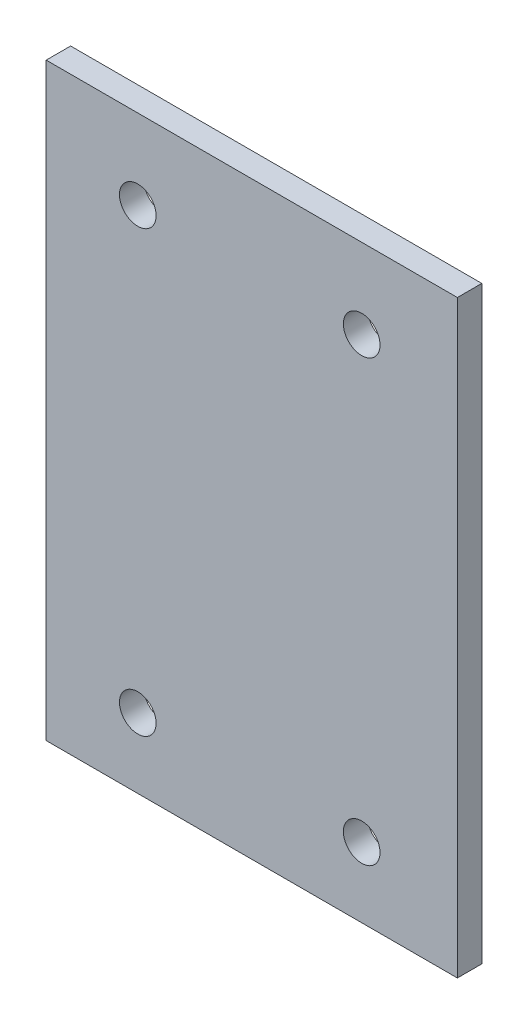
from build123d import *

# Parameters (mm, degrees)
SKETCH1_W           = 101
SKETCH1_H           = 144.760409307
SKETCH1_R           = 4.5
BOSS_EXTRUDE1_DEPTH = 6


with BuildPart() as part:
    # Sketch1 → Boss-Extrude1 (new body)
    with BuildSketch(Plane.XY):
        with Locations((50.5, 72.380204654)):
            Rectangle(SKETCH1_W, SKETCH1_H)
        with Locations((22.5, 125.155945093)):
            Circle(SKETCH1_R, mode=Mode.SUBTRACT)
        with Locations((77.5, 125.155945093)):
            Circle(SKETCH1_R, mode=Mode.SUBTRACT)
        with Locations((77.5, 17.155945093)):
            Circle(SKETCH1_R, mode=Mode.SUBTRACT)
        with Locations((22.5, 17.155945093)):
            Circle(SKETCH1_R, mode=Mode.SUBTRACT)
    extrude(amount=-BOSS_EXTRUDE1_DEPTH)


solid = part.part
